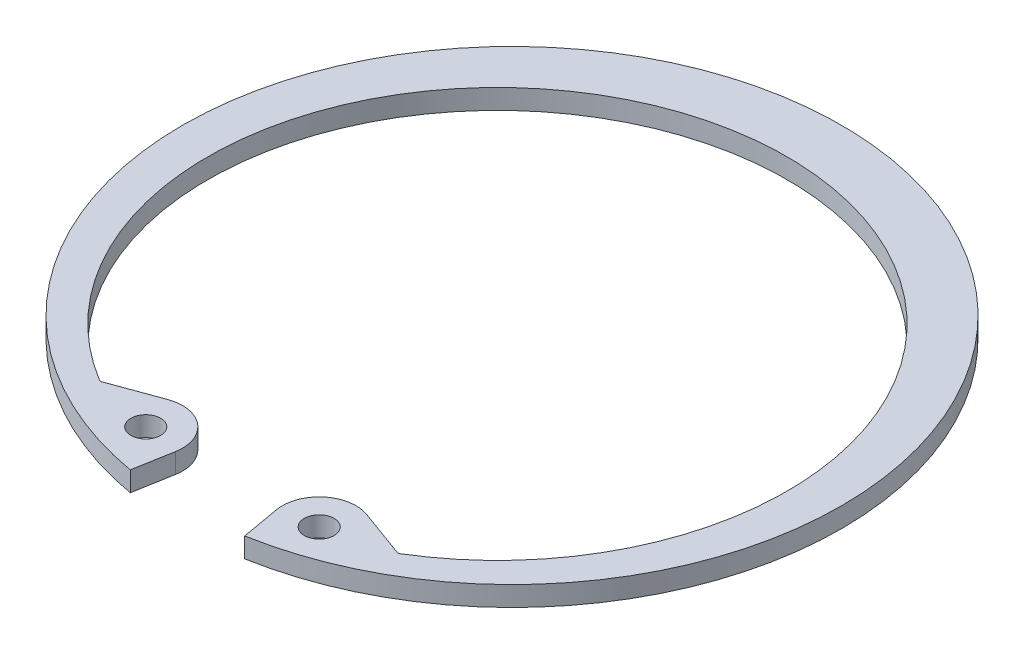
from build123d import *

# Parameters (mm, degrees)
SKETCH2_R      = 1.1811
EXTRUDE1_DEPTH = 1.5748
FILLET1_R      = 0.254


with BuildPart() as part:
    # Sketch2 → Extrude1 (new body)
    with BuildSketch(Plane(origin=(0, 0, 0), x_dir=(1, 0, 0), z_dir=(0, 1, 0))):
        with BuildLine():
            Line((4.534162297, -25.7145122), (3.994863547, -22.655997005))
            ThreePointArc((3.994863547, -22.655997005), (4.993904385, -19.91115486), (7.870527832, -19.403928533))
            Line((7.870527832, -19.403928533), (11.810483262, -20.837955033))
            ThreePointArc((11.810483262, -20.837955033), (0, 21.7932), (-11.810483262, -20.837955033))
            Line((-11.810483262, -20.837955033), (-7.870527832, -19.403928533))
            ThreePointArc((-7.870527832, -19.403928533), (-4.993904385, -19.91115486), (-3.994863547, -22.655997005))
            Line((-3.994863547, -22.655997005), (-4.534162297, -25.7145122))
            ThreePointArc((-4.534162297, -25.7145122), (0, 26.1112), (4.534162297, -25.7145122))
        make_face()
        with Locations((6.871486993, -22.148770678)):
            Circle(SKETCH2_R, mode=Mode.SUBTRACT)
        with Locations((-6.871486993, -22.148770678)):
            Circle(SKETCH2_R, mode=Mode.SUBTRACT)
    extrude(amount=-EXTRUDE1_DEPTH)

    # Fillet1
    fillet1_edges = [part.edges().sort_by_distance(p)[0] for p in [
        (-11.810483262, -0.7874, 20.837955033),
        (11.810483262, -0.7874, 20.837955033),
    ]]
    fillet(fillet1_edges, radius=FILLET1_R)


solid = part.part
